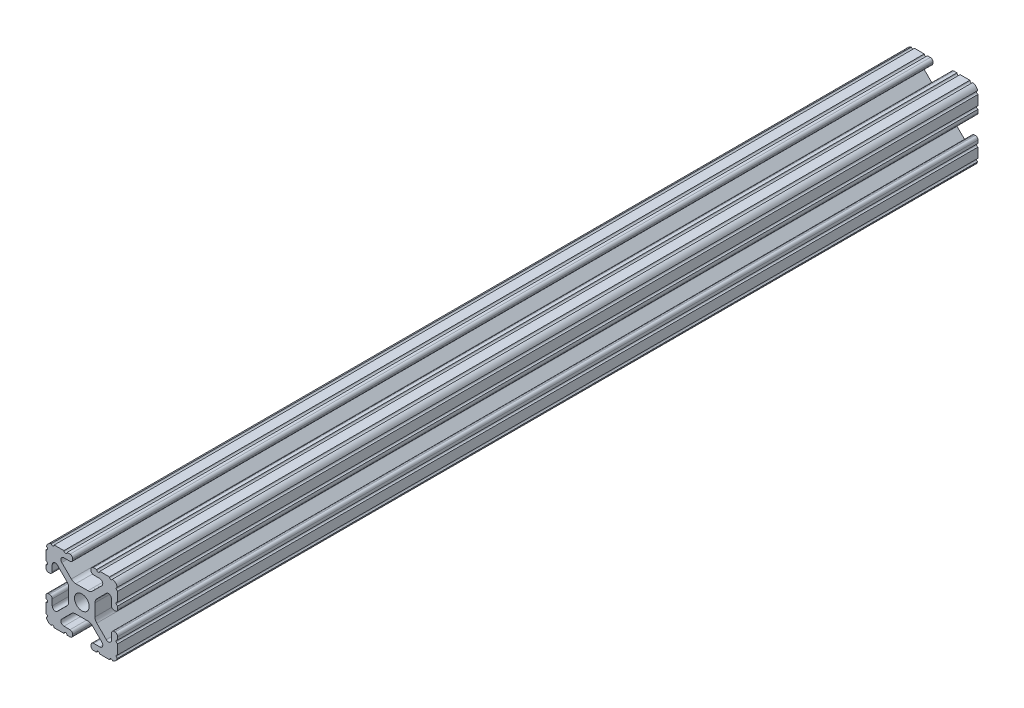
from build123d import *

# Parameters (mm, degrees)
BOSS_EXTRUDE1_START     = -152.4
BOSS_EXTRUDE1_DEPTH     = 304.8
CUT_EXTRUDE1_DEPTH      = 154.454683865
CUT_EXTRUDE1_DEPTH_BACK = 154.454683865
SKETCH5_R               = 0.55245


# Read off the part's stored shape, not the designer's step: Boss-Extrude1
with BuildPart() as part:
    # Boss-Extrude1 outline → Boss-Extrude1 (new body)
    with BuildSketch(Plane.XY.offset(BOSS_EXTRUDE1_START)):
        with BuildLine():
            ThreePointArc((3.2512, -11.760835), (3.52627506, -12.42492494), (4.190365, -12.7))
            Line((4.190365, -12.7), (10.11729625, -12.7))
            ThreePointArc((10.11729625, -12.7), (11.943543585, -11.943543585), (12.7, -10.11729625))
            Line((12.7, -10.11729625), (12.7, -4.190365))
            ThreePointArc((12.7, -4.190365), (12.42492494, -3.52627506), (11.760835, -3.2512))
            Line((11.760835, -3.2512), (11.429365, -3.2512))
            ThreePointArc((11.429365, -3.2512), (10.76527506, -3.52627506), (10.4902, -4.190365))
            Line((10.4902, -4.190365), (10.4902, -6.348478019))
            ThreePointArc((10.4902, -6.348478019), (9.830707141, -7.335478831), (8.666460301, -7.103895736))
            Line((8.666460301, -7.103895736), (5.299899128, -3.737334563))
            ThreePointArc((5.299899128, -3.737334563), (4.817571085, -3.015479635), (4.6482, -2.16399369))
            Line((4.6482, -2.16399369), (4.6482, 0))
            Line((4.6482, 0), (2.6035, 0))
            ThreePointArc((2.6035, 0), (1.840952505, -1.840952505), (0, -2.6035))
            Line((0, -2.6035), (0, -4.6482))
            Line((0, -4.6482), (2.16399369, -4.6482))
            ThreePointArc((2.16399369, -4.6482), (3.015479635, -4.817571085), (3.737334563, -5.299899128))
            Line((3.737334563, -5.299899128), (7.103895736, -8.666460301))
            ThreePointArc((7.103895736, -8.666460301), (7.335478831, -9.830707141), (6.348478019, -10.4902))
            Line((6.348478019, -10.4902), (4.190365, -10.4902))
            ThreePointArc((4.190365, -10.4902), (3.52627506, -10.76527506), (3.2512, -11.429365))
            Line((3.2512, -11.429365), (3.2512, -11.760835))
        make_face()
    extrude(amount=BOSS_EXTRUDE1_DEPTH)

    # Sketch5 → Cut-Extrude1 (cut, two sides: drawn at the far end of the back side and taken through both)
    with BuildSketch(Plane.XY.offset(-CUT_EXTRUDE1_DEPTH_BACK)):
        with Locations((10.356153152, -12.7)):
            Circle(SKETCH5_R)
        with Locations((5.796028019, -12.7)):
            Circle(SKETCH5_R)
        with Locations((12.7, -10.356153152)):
            Circle(SKETCH5_R)
        with Locations((12.7, -5.796028019)):
            Circle(SKETCH5_R)
    extrude(amount=CUT_EXTRUDE1_DEPTH + CUT_EXTRUDE1_DEPTH_BACK, mode=Mode.SUBTRACT)

    # Mirror1: part across plane


with BuildPart() as part_1:
    add(part.part)
    add(part.part.mirror(Plane(origin=(0, 0, 0), x_dir=(0, 0, 1), z_dir=(1, 0, 0))))

    # Mirror2: part across plane


with BuildPart() as part_2:
    add(part_1.part)
    add(part_1.part.mirror(Plane.ZX))


solid = part_2.part
